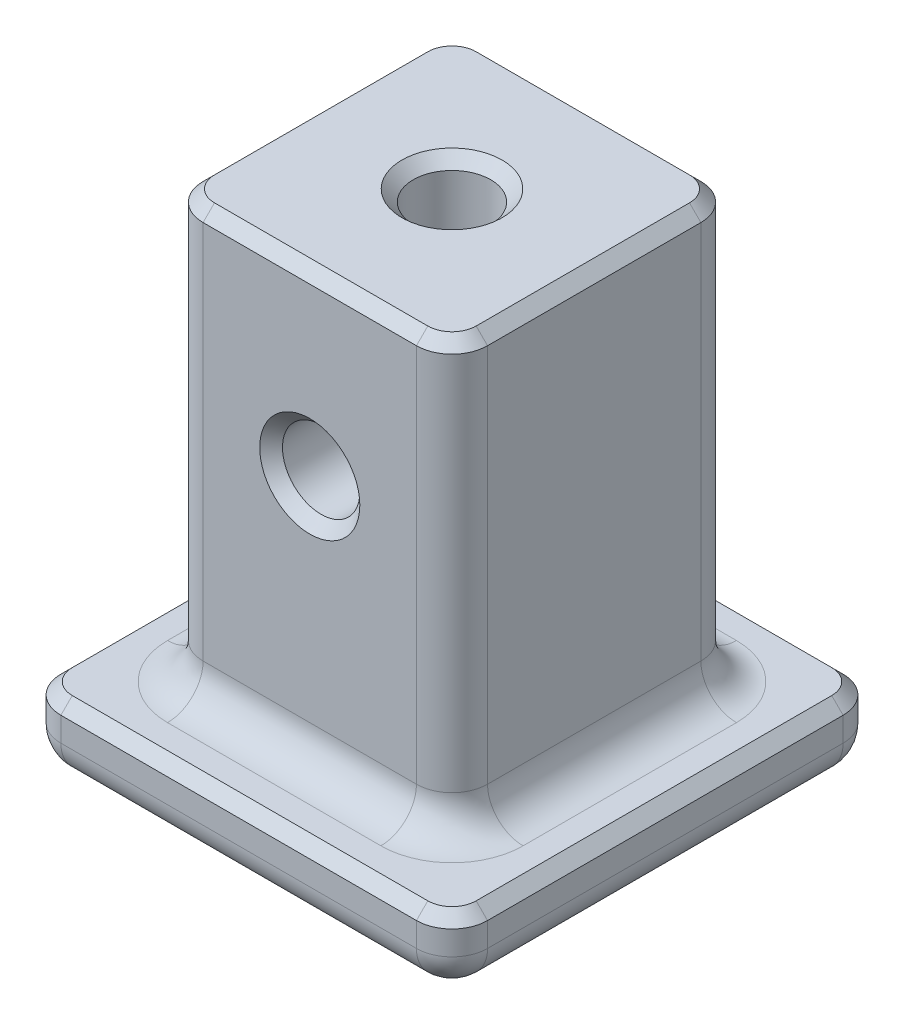
from build123d import *

# Parameters (mm, degrees)
SKETCH1_W             = 19.05
SKETCH1_H             = 19.05
BOSS_EXTRUDE1_DEPTH   = 22.225
SKETCH2_OUTSIDE_W     = 28.034
SKETCH2_OUTSIDE_H     = 28.034
SKETCH2_OUTSIDE_W_2   = 12.7
SKETCH2_OUTSIDE_H_2   = 12.7
CUT_EXTRUDE1_DEPTH    = 19.05
F_8_32_TAPPED_HOLE2_D = 3.4544
F_8_32_TAPPED_HOLE1_D = 3.4544
FILLET1_R             = 1.5875
CHAMFER1_SIZE         = 0.508


with BuildPart() as part:
    # Sketch1 → Boss-Extrude1 (new body)
    with BuildSketch(Plane(origin=(0, 0, 0), x_dir=(1, 0, 0), z_dir=(0, 1, 0))):
        Rectangle(SKETCH1_W, SKETCH1_H)
    extrude(amount=BOSS_EXTRUDE1_DEPTH)

    # Sketch2 outside → Cut-Extrude1 (cut)
    with BuildSketch(Plane(origin=(0, 22.225, 0), x_dir=(1, 0, 0), z_dir=(0, 1, 0))):
        Rectangle(SKETCH2_OUTSIDE_W, SKETCH2_OUTSIDE_H)
        Rectangle(SKETCH2_OUTSIDE_W_2, SKETCH2_OUTSIDE_H_2, mode=Mode.SUBTRACT)
    extrude(amount=-CUT_EXTRUDE1_DEPTH, mode=Mode.SUBTRACT)

    # #8-32 Tapped Hole2 (through all)
    with Locations(Plane(origin=(0, 0, 0), x_dir=(-1, 0, 0), z_dir=(0, -1, 0))):
        with Locations((0, 0)):
            Hole(F_8_32_TAPPED_HOLE2_D / 2)

    # #8-32 Tapped Hole1 (through all)
    with Locations(Plane.XY.offset(6.35)):
        with Locations((0, 14.2875)):
            Hole(F_8_32_TAPPED_HOLE1_D / 2)

    # Fillet1
    fillet1_edges = [part.edges().sort_by_distance(p)[0] for p in [
        (9.525, 1.5875, 9.525),
        (-9.525, 1.5875, 9.525),
        (-9.525, 1.5875, -9.525),
        (9.525, 1.5875, -9.525),
        (0, 3.175, 6.35),
        (6.35, 3.175, 0),
        (0, 3.175, -6.35),
        (-6.35, 3.175, 0),
        (6.35, 12.7, 6.35),
        (-6.35, 12.7, 6.35),
        (-6.35, 12.7, -6.35),
        (6.35, 12.7, -6.35),
        (0, 0, 9.525),
        (-9.525, 0, 0),
        (0, 0, -9.525),
        (9.525, 0, 0),
    ]]
    fillet(fillet1_edges, radius=FILLET1_R - 0.0001)  # a hair under: the kernel refuses the full size

    # Chamfer1
    chamfer1_edges = [part.edges().sort_by_distance(p)[0] for p in [
        (-1.7272, 0, 0),
        (-1.7272, 22.225, 0),
        (1.7272, 14.2875, -6.35),
        (1.7272, 14.2875, 6.35),
        (0, 22.225, 6.35),
        (6.35, 22.225, 0),
        (0, 22.225, -6.35),
        (-6.35, 22.225, 0),
        (-5.885061304, 22.225, -5.885061304),
        (5.885061304, 22.225, -5.885061304),
        (-5.885061304, 22.225, 5.885061304),
        (5.885061304, 22.225, 5.885061304),
        (-9.525, 3.175, 0),
        (0, 3.175, 9.525),
        (9.525, 3.175, 0),
        (0, 3.175, -9.525),
        (9.060061304, 3.175, -9.060061304),
        (-9.060061304, 3.175, -9.060061304),
        (-9.060061304, 3.175, 9.060061304),
        (9.060061304, 3.175, 9.060061304),
    ]]
    chamfer(chamfer1_edges, length=CHAMFER1_SIZE)


solid = part.part
